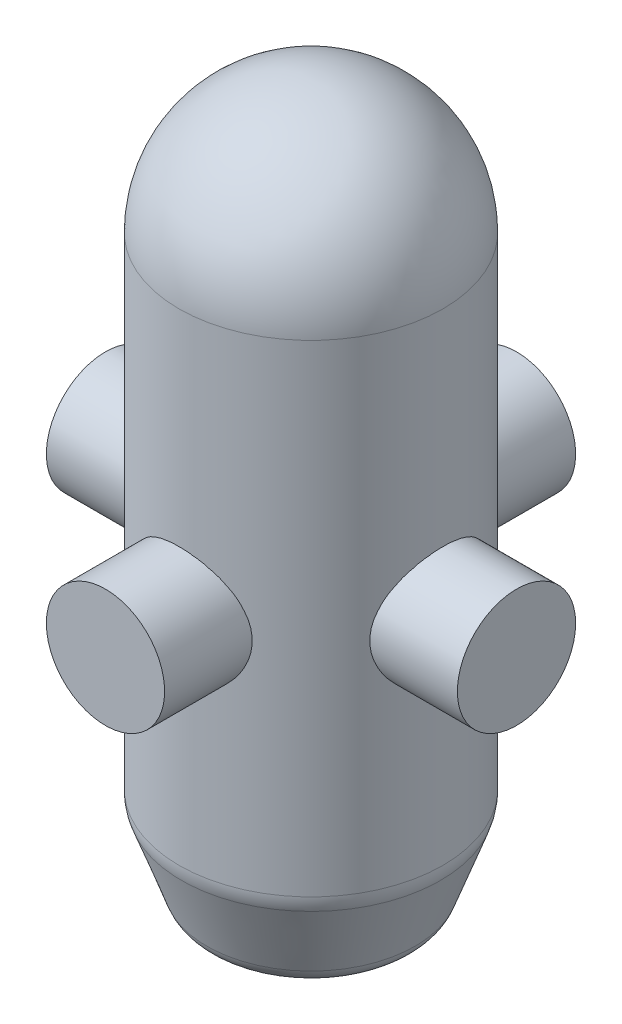
from build123d import *

# Parameters (mm, degrees)
FILLET1_R             = 20
FILLET2_R             = 13
SHELL6_T              = -5
SKETCH3_R             = 28.15
BOSS_EXTRUDE1_DEPTH   = 97.85
BODY_MOVE_COPY1_ANGLE = 90


# Read off the part's stored shape, not the designer's step: Shell8
with BuildPart() as part:
    # Sketch1 → Revolve1 (revolve)
    with BuildSketch(Plane.XY, mode=Mode.PRIVATE) as revolve1_sk:
        Polygon((0, 0), (62.866205, 0), (62.866205, -233), (46.487544458, -278), (0, -278), align=None)
    revolve(revolve1_sk.sketch.rotate(Axis((0, -278, 0), (0, 1, 0)), 90), axis=Axis((0, -278, 0), (0, 1, 0)))

    # Fillet1
    fillet1_edges = [part.edges().sort_by_distance(p)[0] for p in [
        (0, -233, 62.866205),
    ]]
    fillet(fillet1_edges, radius=FILLET1_R)

    # Fillet2
    fillet2_edges = [part.edges().sort_by_distance(p)[0] for p in [
        (0, -278, 46.487544458),
    ]]
    fillet(fillet2_edges, radius=FILLET2_R)

    # Shell6
    shell6_openings = [part.faces().sort_by_distance(p)[0] for p in [
        (0, 0, 0),
    ]]
    offset(amount=SHELL6_T, openings=shell6_openings, kind=Kind.INTERSECTION)


with BuildPart() as body_2:
    # Sketch2 → Revolve3 (revolve)
    with BuildSketch(Plane(origin=(0, 0, 0), x_dir=(0, 0, -1), z_dir=(1, 0, 0)), mode=Mode.PRIVATE) as revolve3_sk:
        with BuildLine():
            Line((-62.866205, 0), (0, 0))
            Line((0, 0), (0, 62.866205))
            ThreePointArc((0, 62.866205), (-44.453119863, 44.453119863), (-62.866205, 0))
        make_face()
    revolve(revolve3_sk.sketch.rotate(Axis((0, 0, 0), (0, 1, 0)), 180), axis=Axis((0, 0, 0), (0, 1, 0)))

    # Shell8 outline → Shell8 (revolve, cut)
    with BuildSketch(Plane.XY):
        with BuildLine():
            Line((0, 5), (57.64978475, 4.999999942))
            ThreePointArc((57.64978475, 4.999999942), (39.109887877, 42.648732119), (0, 57.866205))
            Line((0, 57.866205), (0, 5))
        make_face()
    revolve(axis=Axis((0, 0, 0), (0, 1, 0)), mode=Mode.SUBTRACT)


with BuildPart() as part_1:
    add(part.part)

    # Combine1: union body 2
    add(body_2.part)


with BuildPart() as body_2_2:
    # Sketch3 → Boss-Extrude1 (new, symmetric)
    with BuildSketch(Plane(origin=(0, 0, 0), x_dir=(0, 0, -1), z_dir=(1, 0, 0))):
        with Locations((0, -126.2)):
            Circle(SKETCH3_R)
    extrude(amount=BOSS_EXTRUDE1_DEPTH, both=True)


with BuildPart() as body_3:
    # Body-Move/Copy1: copy of body 2 2
    add(body_2_2.part.rotate(Axis((0, 0, 0), (0, 1, 0)), BODY_MOVE_COPY1_ANGLE))


solid = Compound([part_1.part, body_2_2.part, body_3.part])
